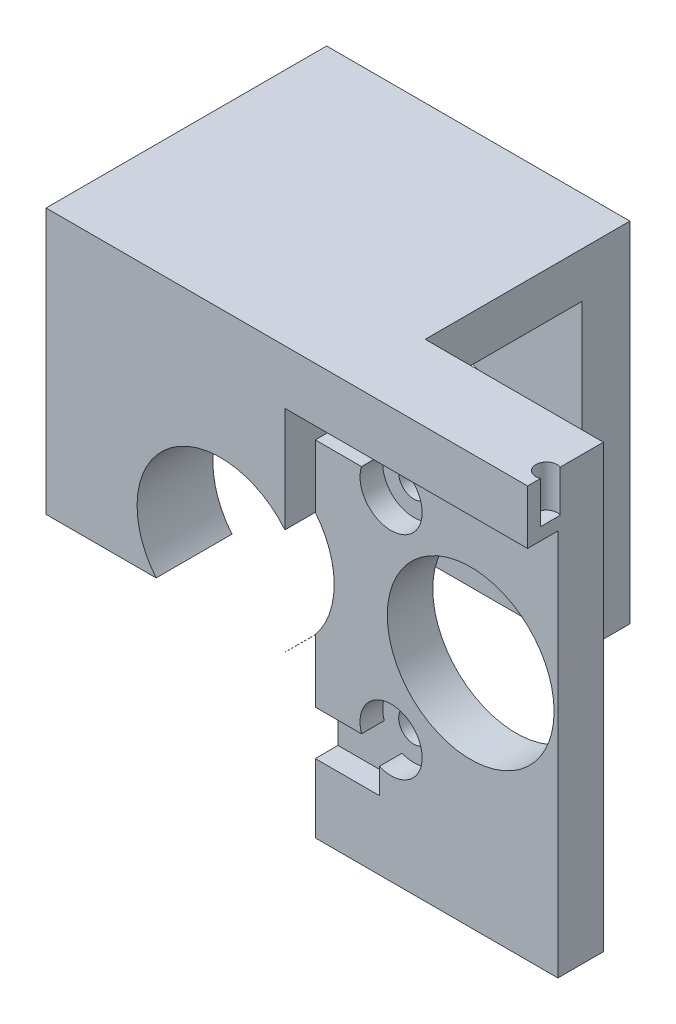
from build123d import *

# Parameters (mm, degrees)
SKETCH1_W           = 93
SKETCH1_H           = 100
BOSS_EXTRUDE2_DEPTH = 10
SKETCH4_W           = 10.01
SKETCH4_H           = 15
BOSS_EXTRUDE4_DEPTH = 24
SKETCH5_R           = 2
CUT_EXTRUDE1_DEPTH  = 50
SKETCH7_R           = 11
CUT_EXTRUDE3_DEPTH  = 50
SKETCH14_W          = 61.5
SKETCH14_H          = 42
CUT_EXTRUDE8_DEPTH  = 4
SKETCH19_R          = 11
CUT_EXTRUDE11_DEPTH = 15
SKETCH20_R          = 2
CUT_EXTRUDE12_DEPTH = 10
SKETCH8_R           = 1.4
CUT_EXTRUDE4_DEPTH  = 5.5
SKETCH21_W          = 40
SKETCH21_H          = 6
BOSS_EXTRUDE5_DEPTH = 27
SKETCH22_W          = 40
SKETCH22_H          = 6.3
BOSS_EXTRUDE7_DEPTH = 40
SKETCH23_R          = 8
CUT_EXTRUDE13_DEPTH = 40
SKETCH24_W          = 118.277817783
SKETCH24_H          = 41.8
CUT_EXTRUDE14_DEPTH = 40
SKETCH25_W          = 31.5
SKETCH25_H          = 23.2
CUT_EXTRUDE15_DEPTH = 20
CUT_EXTRUDE18_DEPTH = 3
SKETCH27_R          = 4.1
SKETCH27_R_2        = 4
CUT_EXTRUDE29_DEPTH = 3
SKETCH28_W          = 29.5
SKETCH28_H          = 58.2
CUT_EXTRUDE30_DEPTH = 23
SKETCH29_W          = 32
SKETCH29_H          = 4
CUT_EXTRUDE31_DEPTH = 23


with BuildPart() as part:
    # Sketch1 → Boss-Extrude2 (new body)
    with BuildSketch(Plane.XY):
        with Locations((-29.68705036, 14.928057554)):
            Rectangle(SKETCH1_W, SKETCH1_H)
    extrude(amount=BOSS_EXTRUDE2_DEPTH)

    # Sketch4 → Boss-Extrude4 (add)
    with BuildSketch(Plane(origin=(16.81294964, 0, 0), x_dir=(0, 0, -1), z_dir=(1, 0, 0))):
        with Locations((-4.995, -12.571942446)):
            Rectangle(SKETCH4_W, SKETCH4_H)
    extrude(amount=BOSS_EXTRUDE4_DEPTH)

    # Sketch5 → Cut-Extrude1 (cut)
    with BuildSketch(Plane(origin=(0, -5.071942446, 0), x_dir=(1, 0, 0), z_dir=(0, 1, 0))):
        with Locations((26.81294964, -5)):
            Circle(SKETCH5_R)
    extrude(amount=-CUT_EXTRUDE1_DEPTH, mode=Mode.SUBTRACT)

    # Sketch7 → Cut-Extrude3 (cut)
    with BuildSketch(Plane(origin=(0, 0, 0), x_dir=(-1, 0, 0), z_dir=(0, 0, -1))):
        with Locations((24.18705036, 36.928057554)):
            Circle(SKETCH7_R)
    extrude(amount=-CUT_EXTRUDE3_DEPTH, mode=Mode.SUBTRACT)

    # Sketch14 → Cut-Extrude8 (cut)
    with BuildSketch(Plane.XY.offset(10)):
        with Locations((-13.93705036, 36.789132279)):
            Rectangle(SKETCH14_W, SKETCH14_H)
    extrude(amount=-CUT_EXTRUDE8_DEPTH, mode=Mode.SUBTRACT)

    # Sketch19 → Cut-Extrude11 (cut)
    with BuildSketch(Plane(origin=(0, 0, 0), x_dir=(-1, 0, 0), z_dir=(0, 0, -1))):
        with Locations((53.18705036, 36.928057554)):
            Circle(SKETCH19_R)
    extrude(amount=-CUT_EXTRUDE11_DEPTH, mode=Mode.SUBTRACT)

    # Sketch20 → Cut-Extrude12 (cut)
    with BuildSketch(Plane.XY.offset(6)):
        with Locations((-34.68705036, 50.928057554)):
            Circle(SKETCH20_R)
        with Locations((5.31294964, 50.928057554)):
            Circle(SKETCH20_R)
        with Locations((-34.68705036, 22.928057554)):
            Circle(SKETCH20_R)
        with Locations((5.31294964, 22.928057554)):
            Circle(SKETCH20_R)
    extrude(amount=-CUT_EXTRUDE12_DEPTH, mode=Mode.SUBTRACT)

    # Sketch8 → Cut-Extrude4 (cut)
    with BuildSketch(Plane(origin=(0, 64.928057554, 0), x_dir=(1, 0, 0), z_dir=(0, 1, 0))):
        with Locations((11.81294964, -7)):
            Circle(SKETCH8_R)
        with Locations((-13.18705036, -7)):
            Circle(SKETCH8_R)
    extrude(amount=-CUT_EXTRUDE4_DEPTH, mode=Mode.SUBTRACT)

    # Sketch21 → Boss-Extrude5 (add)
    with BuildSketch(Plane(origin=(0, 0, 0), x_dir=(-1, 0, 0), z_dir=(0, 0, -1))):
        with Locations((56.18705036, 61.928057554)):
            Rectangle(SKETCH21_W, SKETCH21_H)
    extrude(amount=BOSS_EXTRUDE5_DEPTH)

    # Sketch22 → Boss-Extrude7 (add)
    with BuildSketch(Plane.XZ.offset(-58.928057554)):
        with Locations((-56.18705036, -23.85)):
            Rectangle(SKETCH22_W, SKETCH22_H)
    extrude(amount=BOSS_EXTRUDE7_DEPTH)

    # Sketch23 → Cut-Extrude13 (cut)
    with BuildSketch(Plane.XY.offset(10)):
        with Locations((-53.18705036, 36.928057554)):
            Circle(SKETCH23_R)
    extrude(amount=-CUT_EXTRUDE13_DEPTH, mode=Mode.SUBTRACT)

    # Sketch24 → Cut-Extrude14 (cut)
    with BuildSketch(Plane.XY.offset(10)):
        with Locations((-17.048141468, -14.171942446)):
            Rectangle(SKETCH24_W, SKETCH24_H)
    extrude(amount=-CUT_EXTRUDE14_DEPTH, mode=Mode.SUBTRACT)

    # Sketch25 → Cut-Extrude15 (cut)
    with BuildSketch(Plane.XY.offset(10)):
        with Locations((-60.43705036, 18.328057554)):
            Rectangle(SKETCH25_W, SKETCH25_H)
    extrude(amount=-CUT_EXTRUDE15_DEPTH, mode=Mode.SUBTRACT)

    # Sketch26 → Cut-Extrude18 (cut)
    with BuildSketch(Plane.XY.offset(6)):
        with BuildLine():
            Line((-44.68705036, 21.664686216), (-44.68705036, 15.789132279))
            Line((-44.68705036, 15.789132279), (-36.237499605, 15.789132279))
            Line((-36.237499605, 15.789132279), (-36.237499605, 19.240767609))
            ThreePointArc((-36.237499605, 19.240767609), (-37.621834849, 20.210146592), (-38.482296447, 21.664686216))
            Line((-38.482296447, 21.664686216), (-44.68705036, 21.664686216))
        make_face()
        with BuildLine():
            Line((6.863398886, 19.240767609), (6.863398886, 15.789132279))
            Line((6.863398886, 15.789132279), (14.30212304, 15.789132279))
            Line((14.30212304, 15.789132279), (14.30212304, 20.928057554))
            Line((14.30212304, 20.928057554), (8.777051255, 20.928057554))
            ThreePointArc((8.777051255, 20.928057554), (7.95835451, 19.927752057), (6.863398886, 19.240767609))
        make_face()
        with BuildLine():
            Line((14.30212304, 57.789132279), (6.863398886, 57.789132279))
            Line((6.863398886, 57.789132279), (6.863398886, 54.615347499))
            ThreePointArc((6.863398886, 54.615347499), (8.24773413, 53.645968516), (9.108195728, 52.191428892))
            Line((9.108195728, 52.191428892), (14.30212304, 52.191428892))
            Line((14.30212304, 52.191428892), (14.30212304, 57.789132279))
        make_face()
        with BuildLine():
            Line((-36.237499605, 57.789132279), (-44.68705036, 57.789132279))
            Line((-44.68705036, 57.789132279), (-44.68705036, 52.191428892))
            Line((-44.68705036, 52.191428892), (-38.482296447, 52.191428892))
            ThreePointArc((-38.482296447, 52.191428892), (-37.621834849, 53.645968516), (-36.237499605, 54.615347499))
            Line((-36.237499605, 54.615347499), (-36.237499605, 57.789132279))
        make_face()
    extrude(amount=-CUT_EXTRUDE18_DEPTH, mode=Mode.SUBTRACT)

    # Sketch27 → Cut-Extrude29 (cut)
    with BuildSketch(Plane.XY.offset(6)):
        with Locations((5.31294964, 50.928057554)):
            Circle(SKETCH27_R)
        with Locations((5.31294964, 22.928057554)):
            Circle(SKETCH27_R_2)
        with Locations((-34.68705036, 50.928057554)):
            Circle(SKETCH27_R)
        with Locations((-34.68705036, 22.928057554)):
            Circle(SKETCH27_R)
    extrude(amount=-CUT_EXTRUDE29_DEPTH, mode=Mode.SUBTRACT)

    # Sketch28 → Cut-Extrude30 (cut)
    with BuildSketch(Plane(origin=(0, 0, 0), x_dir=(-1, 0, 0), z_dir=(0, 0, -1))):
        with Locations((-2.06294964, 35.828057554)):
            Rectangle(SKETCH28_W, SKETCH28_H)
    extrude(amount=-CUT_EXTRUDE30_DEPTH, mode=Mode.SUBTRACT)

    # Sketch29 → Cut-Extrude31 (cut)
    with BuildSketch(Plane(origin=(0, 15.789132279, 0), x_dir=(1, 0, 0), z_dir=(0, 1, 0))):
        with Locations((-28.68705036, -8)):
            Rectangle(SKETCH29_W, SKETCH29_H)
    extrude(amount=-CUT_EXTRUDE31_DEPTH, mode=Mode.SUBTRACT)


solid = part.part
